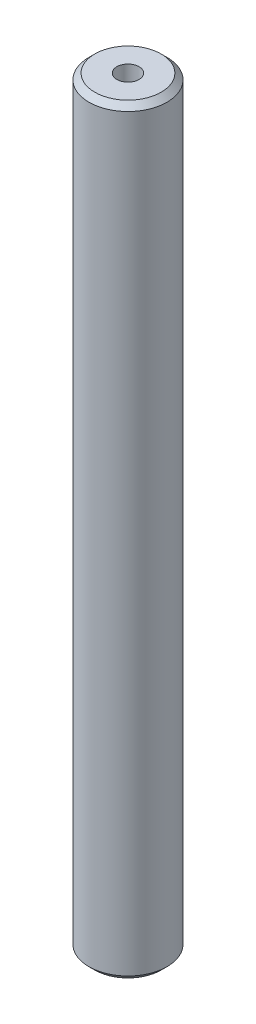
from build123d import *

# Parameters (mm, degrees)
SKETCH1_R           = 5
BOSS_EXTRUDE1_DEPTH = 97.565968443
SKETCH2_R           = 1.427704995
CUT_EXTRUDE1_DEPTH  = 98.821869734
CHAMFER1_SIZE       = 0.741434958


with BuildPart() as part:
    # Sketch1 → Boss-Extrude1 (new body)
    with BuildSketch(Plane(origin=(0, 0, 0), x_dir=(1, 0, 0), z_dir=(0, 1, 0))):
        Circle(SKETCH1_R)
    extrude(amount=BOSS_EXTRUDE1_DEPTH)

    # Sketch2 → Cut-Extrude1 (cut, through all)
    with BuildSketch(Plane(origin=(0, 0, 0), x_dir=(1, 0, 0), z_dir=(0, 1, 0))):
        Circle(SKETCH2_R)
    extrude(amount=CUT_EXTRUDE1_DEPTH, mode=Mode.SUBTRACT)

    # Chamfer1
    chamfer1_edges = [part.edges().sort_by_distance(p)[0] for p in [
        (-5, 97.565968443, 0),
        (-5, 0, 0),
    ]]
    chamfer(chamfer1_edges, length=CHAMFER1_SIZE)


solid = part.part
